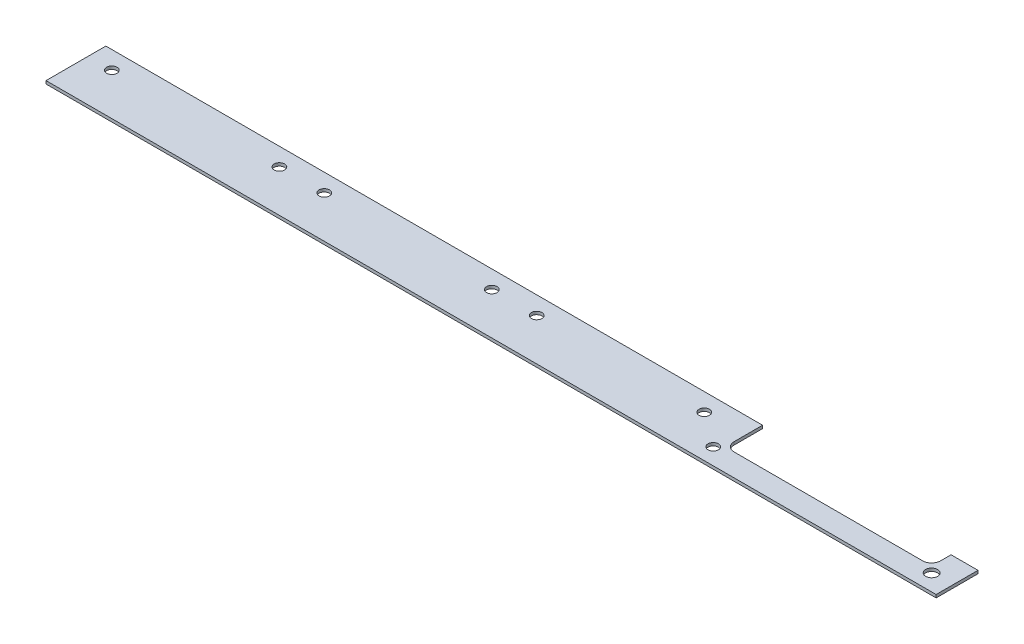
from build123d import *

# Parameters (mm, degrees)
SKETCH_1_R      = 1.75
SKETCH_1_R_2    = 2
EXTRUDE_1_DEPTH = 1


with BuildPart() as part:
    # Эскиз1 → Бобышка-Вытянуть1 (new body)
    with BuildSketch(Plane(origin=(0, 0, 0), x_dir=(1, 0, 0), z_dir=(0, 1, 0))):
        with BuildLine():
            Line((219.5, 20), (219.5, 10.5))
            ThreePointArc((219.5, 10.5), (220.378679656, 8.378679656), (222.5, 7.5))
            Line((222.5, 7.5), (285.5, 7.5))
            ThreePointArc((285.5, 7.5), (287.621320344, 8.378679656), (288.5, 10.5))
            Line((288.5, 10.5), (288.5, 14))
            Line((288.5, 14), (297.5, 14))
            Line((297.5, 14), (297.5, 0))
            Line((297.5, 0), (0, 0))
            Line((0, 0), (0, 20))
            Line((0, 20), (219.5, 20))
        make_face()
        with Locations((217.5, 5.5)):
            Circle(SKETCH_1_R, mode=Mode.SUBTRACT)
        with Locations((64, 14)):
            Circle(SKETCH_1_R, mode=Mode.SUBTRACT)
        with Locations((8, 14)):
            Circle(SKETCH_1_R, mode=Mode.SUBTRACT)
        with Locations((79, 14)):
            Circle(SKETCH_1_R, mode=Mode.SUBTRACT)
        with Locations((135, 14)):
            Circle(SKETCH_1_R, mode=Mode.SUBTRACT)
        with Locations((290.5, 5.5)):
            Circle(SKETCH_1_R_2, mode=Mode.SUBTRACT)
        with Locations((150, 14)):
            Circle(SKETCH_1_R, mode=Mode.SUBTRACT)
        with Locations((206, 14)):
            Circle(SKETCH_1_R, mode=Mode.SUBTRACT)
    extrude(amount=EXTRUDE_1_DEPTH)


solid = part.part
